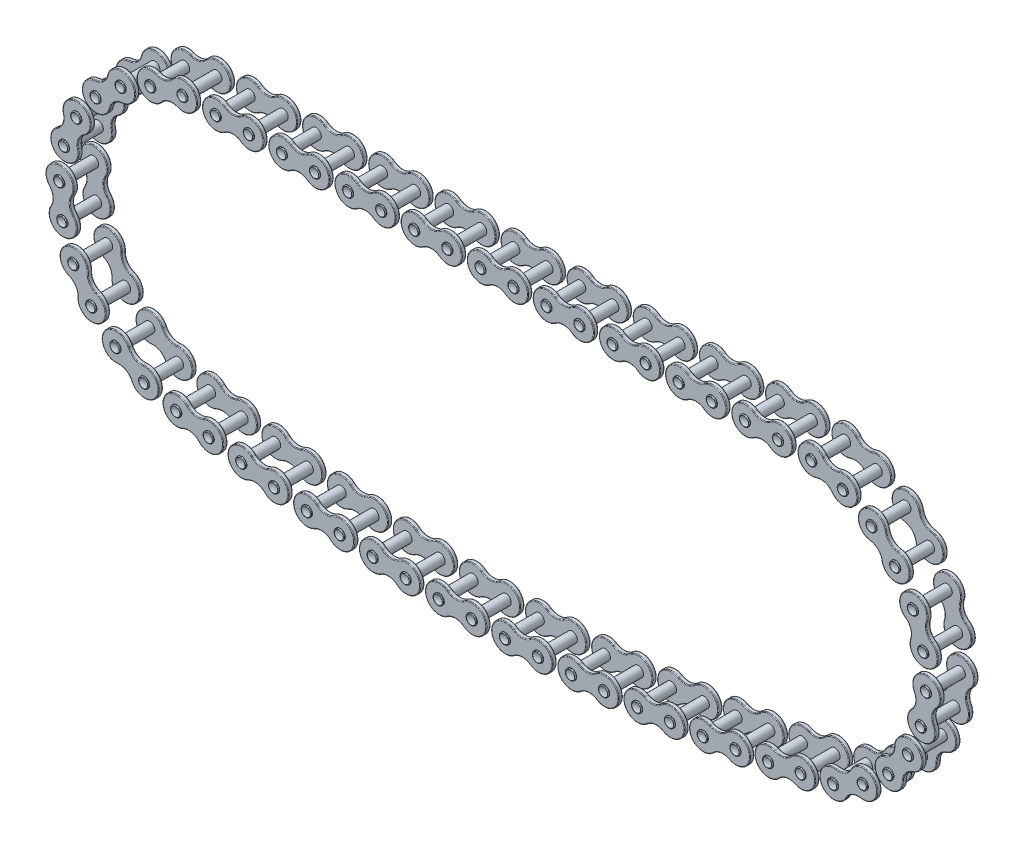
from build123d import *

# Parameters (mm, degrees)
SKETCH2_R            = 1.9812
BOSS_EXTRUDE1_DEPTH  = 1.5875
BOSS_EXTRUDE2_START  = 0.508
SKETCH3_R            = 1.9812
BOSS_EXTRUDE2_DEPTH  = 15.573248
FILLET3_R            = 0.254
FILLET4_R            = 0.254
CRVPATTERN1_6_ANGLE  = 13.5577506
CRVPATTERN1_7_ANGLE  = 40.8674644
CRVPATTERN1_8_ANGLE  = 68.1771781
CRVPATTERN1_9_ANGLE  = 95.4868919
CRVPATTERN1_10_ANGLE = 122.7966057
CRVPATTERN1_11_ANGLE = 150.1063195
CRVPATTERN1_12_ANGLE = 168.8160777
CRVPATTERN1_13_ANGLE = 171.2662276
CRVPATTERN1_14_ANGLE = 173.7163776
CRVPATTERN1_15_ANGLE = 176.1665275
CRVPATTERN1_16_ANGLE = 178.6166775
CRVPATTERN1_17_ANGLE = 178.9331725
CRVPATTERN1_18_ANGLE = 176.4830226
CRVPATTERN1_19_ANGLE = 174.0328726
CRVPATTERN1_20_ANGLE = 171.5827227
CRVPATTERN1_21_ANGLE = 169.1325727
CRVPATTERN1_22_ANGLE = 153.6340174
CRVPATTERN1_23_ANGLE = 126.3243036
CRVPATTERN1_24_ANGLE = 99.0145899
CRVPATTERN1_25_ANGLE = 71.7048761
CRVPATTERN1_26_ANGLE = 44.3951623
CRVPATTERN1_27_ANGLE = 17.0854485


with BuildPart() as part:
    # Sketch2 → Boss-Extrude1 (new body)
    with BuildSketch(Plane.XY):
        with BuildLine():
            ThreePointArc((3.139649147, -4.338969192), (11.7475, 0), (3.139649147, 4.338969192))
            ThreePointArc((3.139649147, 4.338969192), (0, 3.303750457), (-3.139649147, 4.338969192))
            ThreePointArc((-3.139649147, 4.338969192), (-11.7475, 0), (-3.139649147, -4.338969192))
            ThreePointArc((-3.139649147, -4.338969192), (0, -3.303750457), (3.139649147, -4.338969192))
        make_face()
        with Locations((6.35, 0)):
            Circle(SKETCH2_R, mode=Mode.SUBTRACT)
        with Locations(Location((-6.35, 0, 0), (0, 0, 180))):
            Circle(SKETCH2_R, mode=Mode.SUBTRACT)
    boss_extrude1 = extrude(amount=BOSS_EXTRUDE1_DEPTH)

    # Sketch3 → Boss-Extrude2 (add)
    with BuildSketch(Plane(origin=(0, 0, 0), x_dir=(-1, 0, 0), z_dir=(0, 0, -1)).offset(BOSS_EXTRUDE2_START)):
        with Locations(Location((6.35, 0, 0), (0, 0, 180))):
            Circle(SKETCH3_R)
    boss_extrude2 = extrude(amount=-BOSS_EXTRUDE2_DEPTH)

    # Mirror1: Boss-Extrude1 across plane
    add(boss_extrude1.mirror(Plane(origin=(0, 0, 7.278624), x_dir=(1, 0, 0), z_dir=(0, 0, -1))))

    # Sketch4 → Cut-Revolve1 (revolve, cut)
    with BuildSketch(Plane(origin=(0, 0, 0), x_dir=(1, 0, 0), z_dir=(0, 1, 0))):
        with BuildLine():
            Line((-6.35, -14.557248), (-6.35, -15.37974572))
            Line((-6.35, -15.37974572), (-8.482219037, -15.37974572))
            ThreePointArc((-8.482219037, -15.37974572), (-7.492678927, -14.770000564), (-6.35, -14.557248))
        make_face()
    cut_revolve1 = revolve(axis=Axis((-6.35, 0, 14.557248), (0, 0, 1)), mode=Mode.SUBTRACT)

    # Mirror2: Boss-Extrude2, Cut-Revolve1 across plane
    add(boss_extrude2.mirror(Plane(origin=(0, 0, 0), x_dir=(0, 0, 1), z_dir=(1, 0, 0))))
    add(cut_revolve1.mirror(Plane(origin=(0, 0, 0), x_dir=(0, 0, 1), z_dir=(1, 0, 0))), mode=Mode.SUBTRACT)

    # Mirror3: Cut-Revolve1 across plane
    add(cut_revolve1.mirror(Plane(origin=(0, 0, 7.278624), x_dir=(1, 0, 0), z_dir=(0, 0, -1))), mode=Mode.SUBTRACT)

    # Mirror4 copy 1 sketch → Mirror4 copy 1 (revolve, cut)
    with BuildSketch(Plane(origin=(0, 0, 14.557248), x_dir=(-1, 0, 0), z_dir=(0, 1, 0))):
        with BuildLine():
            Line((-6.35, -14.557248), (-6.35, -15.37974572))
            Line((-6.35, -15.37974572), (-8.482219037, -15.37974572))
            ThreePointArc((-8.482219037, -15.37974572), (-7.492678927, -14.770000564), (-6.35, -14.557248))
        make_face()
    revolve(axis=Axis((6.35, 0, 0), (0, 0, -1)), mode=Mode.SUBTRACT)

    # Mirror4 copy 2 sketch → Mirror4 copy 2 (revolve, cut)
    with BuildSketch(Plane(origin=(0, 0, 0), x_dir=(-1, 0, 0), z_dir=(0, 1, 0))):
        with BuildLine():
            Line((-6.35, 14.557248), (-6.35, 15.37974572))
            Line((-6.35, 15.37974572), (-8.482219037, 15.37974572))
            ThreePointArc((-8.482219037, 15.37974572), (-7.492678927, 14.770000564), (-6.35, 14.557248))
        make_face()
    revolve(axis=Axis((6.35, 0, 14.557248), (0, 0, -1)), mode=Mode.SUBTRACT)

    # Fillet3
    fillet3_edges = [part.edges().sort_by_distance(p)[0] for p in [
        (-8.3312, 0, 15.065248),
        (-8.3312, 0, -0.508),
        (8.3312, 0, -0.508),
        (8.3312, 0, 15.065248),
    ]]
    fillet(fillet3_edges, radius=FILLET3_R)

    # Fillet4
    fillet4_edges = [part.edges().sort_by_distance(p)[0] for p in [
        (0, -3.303750457, 1.5875),
        (11.7475, 0, 1.5875),
        (0, 3.303750457, 12.969748),
        (11.7475, 0, 12.969748),
        (0, -3.303750457, 12.969748),
        (-11.7475, 0, 12.969748),
        (0, 3.303750457, 14.557248),
        (-11.7475, 0, 14.557248),
        (0, -3.303750457, 14.557248),
        (11.7475, 0, 14.557248),
        (0, 3.303750457, 1.5875),
        (11.7475, 0, 0),
        (0, -3.303750457, 0),
        (-11.7475, 0, 0),
        (0, 3.303750457, 0),
        (-11.7475, 0, 1.5875),
    ]]
    fillet(fillet4_edges, radius=FILLET4_R)


with BuildPart() as body_2:
    # CrvPattern1: read off the stored shape, not the designer's step
    # CrvPattern1: copy of part
    add(part.part.moved(Location((-25.3096841, 0, 0))))


with BuildPart() as body_3:
    # CrvPattern1 2: copy of part
    add(part.part.moved(Location((-50.7096841, 0, 0))))


with BuildPart() as body_4:
    # CrvPattern1 3: copy of part
    add(part.part.moved(Location((-76.1096841, 0, 0))))


with BuildPart() as body_5:
    # CrvPattern1 4: copy of part
    add(part.part.moved(Location((-101.5096841, 0, 0))))


with BuildPart() as body_6:
    # CrvPattern1 5: copy of part
    add(part.part.moved(Location((-126.9096841, 0, 0))))


with BuildPart() as body_7:
    # CrvPattern1 6: copy of part
    add(part.part.moved(Location((-148.2994762, 34.2341691, 0))).rotate(Axis((0, 0, 0), (0, 0, 1)), CRVPATTERN1_6_ANGLE))


with BuildPart() as body_8:
    # CrvPattern1 7: copy of part
    add(part.part.moved(Location((-140.5123887, 104.3978827, 0))).rotate(Axis((0, 0, 0), (0, 0, 1)), CRVPATTERN1_7_ANGLE))


with BuildPart() as body_9:
    # CrvPattern1 8: copy of part
    add(part.part.moved(Location((-101.4021283, 163.1683937, 0))).rotate(Axis((0, 0, 0), (0, 0, 1)), CRVPATTERN1_8_ANGLE))


with BuildPart() as body_10:
    # CrvPattern1 9: copy of part
    add(part.part.moved(Location((-39.6871962, 197.4445166, 0))).rotate(Axis((0, 0, 0), (0, 0, 1)), CRVPATTERN1_9_ANGLE))


with BuildPart() as body_11:
    # CrvPattern1 10: copy of part
    add(part.part.moved(Location((30.8748484, 199.585381, 0))).rotate(Axis((0, 0, 0), (0, 0, 1)), CRVPATTERN1_10_ANGLE))


with BuildPart() as body_12:
    # CrvPattern1 11: copy of part
    add(part.part.moved(Location((94.5542385, 169.1137432, 0))).rotate(Axis((0, 0, 0), (0, 0, 1)), CRVPATTERN1_11_ANGLE))


with BuildPart() as body_13:
    # CrvPattern1 12: copy of part
    add(part.part.moved(Location((118.7128337, 132.7216639, 0))).rotate(Axis((0, 0, 0), (0, 0, 1)), CRVPATTERN1_12_ANGLE))


with BuildPart() as body_14:
    # CrvPattern1 13: copy of part
    add(part.part.moved(Location((98.8859178, 128.068347, 0))).rotate(Axis((0, 0, 0), (0, 0, 1)), CRVPATTERN1_13_ANGLE))


with BuildPart() as body_15:
    # CrvPattern1 14: copy of part
    add(part.part.moved(Location((78.8781977, 124.2668879, 0))).rotate(Axis((0, 0, 0), (0, 0, 1)), CRVPATTERN1_14_ANGLE))


with BuildPart() as body_16:
    # CrvPattern1 15: copy of part
    add(part.part.moved(Location((58.7262559, 121.3242372, 0))).rotate(Axis((0, 0, 0), (0, 0, 1)), CRVPATTERN1_15_ANGLE))


with BuildPart() as body_17:
    # CrvPattern1 16: copy of part
    add(part.part.moved(Location((38.4669383, 119.2457752, 0))).rotate(Axis((0, 0, 0), (0, 0, 1)), CRVPATTERN1_16_ANGLE))


with BuildPart() as body_18:
    # CrvPattern1 17: copy of part
    add(part.part.moved(Location((18.1372873, 118.0353023, 0))).rotate(Axis((0, 0, 0), (0, 0, -1)), CRVPATTERN1_17_ANGLE))


with BuildPart() as body_19:
    # CrvPattern1 18: copy of part
    add(part.part.moved(Location((-2.2255261, 117.6950317, 0))).rotate(Axis((0, 0, 0), (0, 0, -1)), CRVPATTERN1_18_ANGLE))


with BuildPart() as body_20:
    # CrvPattern1 19: copy of part
    add(part.part.moved(Location((-22.5842703, 118.2255855, 0))).rotate(Axis((0, 0, 0), (0, 0, -1)), CRVPATTERN1_19_ANGLE))


with BuildPart() as body_21:
    # CrvPattern1 20: copy of part
    add(part.part.moved(Location((-42.9017212, 119.6259936, 0))).rotate(Axis((0, 0, 0), (0, 0, -1)), CRVPATTERN1_20_ANGLE))


with BuildPart() as body_22:
    # CrvPattern1 21: copy of part
    add(part.part.moved(Location((-63.1407301, 121.8936956, 0))).rotate(Axis((0, 0, 0), (0, 0, -1)), CRVPATTERN1_21_ANGLE))


with BuildPart() as body_23:
    # CrvPattern1 22: copy of part
    add(part.part.moved(Location((-53.1275334, 139.0988068, 0))).rotate(Axis((0, 0, 0), (0, 0, -1)), CRVPATTERN1_22_ANGLE))


with BuildPart() as body_24:
    # CrvPattern1 23: copy of part
    add(part.part.moved(Location((-7.836445, 153.9093449, 0))).rotate(Axis((0, 0, 0), (0, 0, -1)), CRVPATTERN1_23_ANGLE))


with BuildPart() as body_25:
    # CrvPattern1 24: copy of part
    add(part.part.moved(Location((39.2015522, 146.2895319, 0))).rotate(Axis((0, 0, 0), (0, 0, -1)), CRVPATTERN1_24_ANGLE))


with BuildPart() as body_26:
    # CrvPattern1 25: copy of part
    add(part.part.moved(Location((77.5006971, 117.9379848, 0))).rotate(Axis((0, 0, 0), (0, 0, -1)), CRVPATTERN1_25_ANGLE))


with BuildPart() as body_27:
    # CrvPattern1 26: copy of part
    add(part.part.moved(Location((98.5233032, 75.174861, 0))).rotate(Axis((0, 0, 0), (0, 0, -1)), CRVPATTERN1_26_ANGLE))


with BuildPart() as body_28:
    # CrvPattern1 27: copy of part
    add(part.part.moved(Location((97.5829884, 27.532962, 0))).rotate(Axis((0, 0, 0), (0, 0, -1)), CRVPATTERN1_27_ANGLE))


with BuildPart() as body_29:
    # CrvPattern1 28: copy of part
    add(part.part.moved(Location((76.2, 0, 0))))


with BuildPart() as body_30:
    # CrvPattern1 29: copy of part
    add(part.part.moved(Location((50.8, 0, 0))))


with BuildPart() as body_31:
    # CrvPattern1 30: copy of part
    add(part.part.moved(Location((25.4, 0, 0))))


solid = Compound([part.part, body_2.part, body_3.part, body_4.part, body_5.part, body_6.part, body_7.part, body_8.part, body_9.part, body_10.part, body_11.part, body_12.part, body_13.part, body_14.part, body_15.part, body_16.part, body_17.part, body_18.part, body_19.part, body_20.part, body_21.part, body_22.part, body_23.part, body_24.part, body_25.part, body_26.part, body_27.part, body_28.part, body_29.part, body_30.part, body_31.part])
